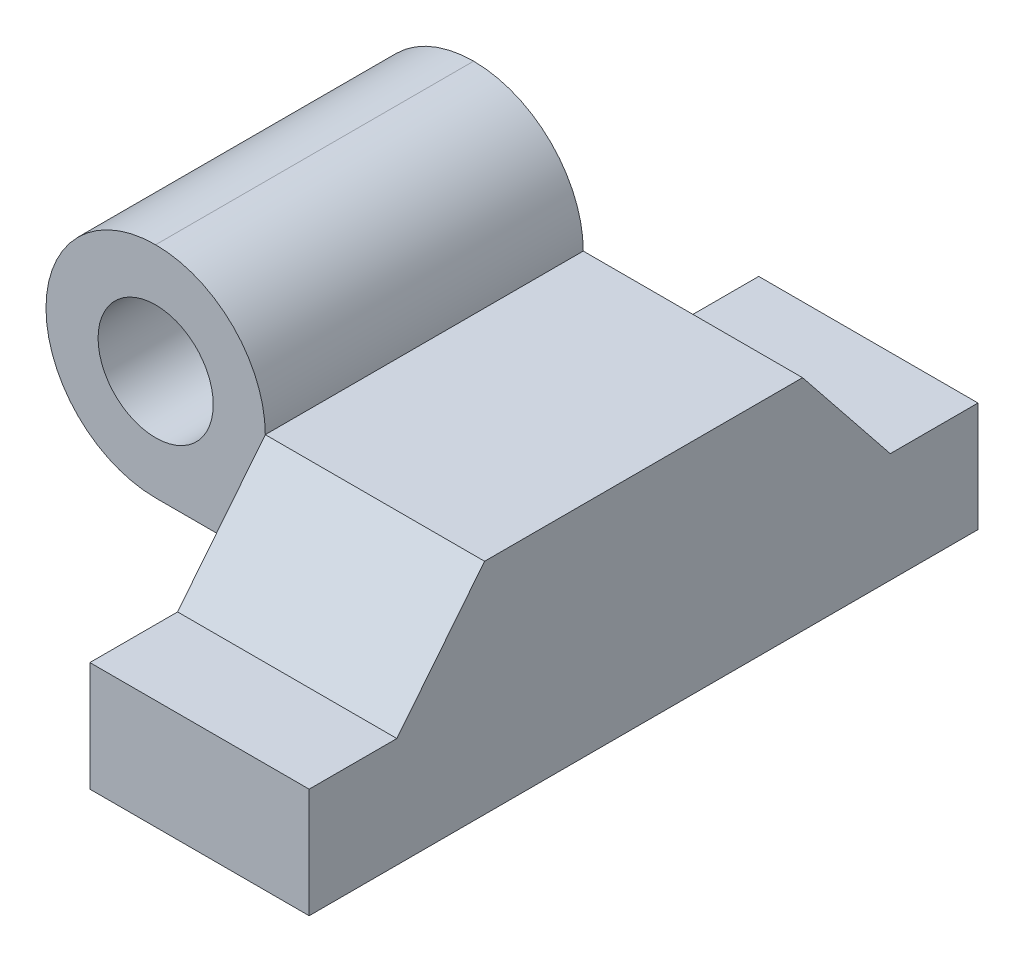
from build123d import *

# Parameters (mm, degrees)
SKETCH1_W           = 12
SKETCH1_H           = 18.3
BOSS_EXTRUDE1_DEPTH = 3
SKETCH2_W           = 6
SKETCH2_H           = 8.7
BOSS_EXTRUDE2_DEPTH = 6
SKETCH3_R           = 1.575
CUT_EXTRUDE1_DEPTH  = 22.257704486
FILLET1_R           = 3
SKETCH4_W           = 6
SKETCH4_H           = 8.7
BOSS_EXTRUDE3_DEPTH = 3
SKETCH5_W           = 6
SKETCH5_H           = 18.3
CUT_EXTRUDE2_DEPTH  = 3
FILLET2_R           = 3
BOSS_EXTRUDE4_DEPTH = 6


with BuildPart() as part:
    # Sketch1 → Boss-Extrude1 (new body)
    with BuildSketch(Plane(origin=(0, 0, 0), x_dir=(1, 0, 0), z_dir=(0, 1, 0))):
        Rectangle(SKETCH1_W, SKETCH1_H)
    extrude(amount=BOSS_EXTRUDE1_DEPTH)

    # Sketch2 → Boss-Extrude2 (add)
    with BuildSketch(Plane(origin=(0, 3, 0), x_dir=(1, 0, 0), z_dir=(0, 1, 0))):
        with Locations((-3, 0)):
            Rectangle(SKETCH2_W, SKETCH2_H)
    extrude(amount=BOSS_EXTRUDE2_DEPTH)

    # Sketch3 → Cut-Extrude1 (cut, through all)
    with BuildSketch(Plane.XY.offset(9.15)):
        with Locations((-3, 6)):
            Circle(SKETCH3_R)
    extrude(amount=-CUT_EXTRUDE1_DEPTH, mode=Mode.SUBTRACT)

    # Fillet1
    fillet1_edges = [part.edges().sort_by_distance(p)[0] for p in [
        (-6, 9, 0),
        (0, 9, 0),
    ]]
    fillet(fillet1_edges, radius=FILLET1_R - 0.0001)  # a hair under: the kernel refuses the full size

    # Sketch4 → Boss-Extrude3 (add)
    with BuildSketch(Plane(origin=(0, 3, 0), x_dir=(1, 0, 0), z_dir=(0, 1, 0))):
        with Locations((3, 0)):
            Rectangle(SKETCH4_W, SKETCH4_H)
    extrude(amount=BOSS_EXTRUDE3_DEPTH)

    # Sketch5 → Cut-Extrude2 (cut)
    with BuildSketch(Plane.XZ):
        with Locations((-3, 0)):
            Rectangle(SKETCH5_W, SKETCH5_H)
    extrude(amount=-CUT_EXTRUDE2_DEPTH, mode=Mode.SUBTRACT)

    # Fillet2
    fillet2_edges = [part.edges().sort_by_distance(p)[0] for p in [
        (-6, 3, 0),
    ]]
    fillet(fillet2_edges, radius=FILLET2_R)

    # Sketch6 → Boss-Extrude4 (add)
    with BuildSketch(Plane(origin=(6, 0, 0), x_dir=(0, 0, -1), z_dir=(1, 0, 0))):
        Polygon((4.35, 3), (6.75, 3), (4.35, 6), align=None)
        Polygon((-4.35, 3), (-4.35, 6), (-6.75, 3), align=None)
    extrude(amount=-BOSS_EXTRUDE4_DEPTH)


solid = part.part
